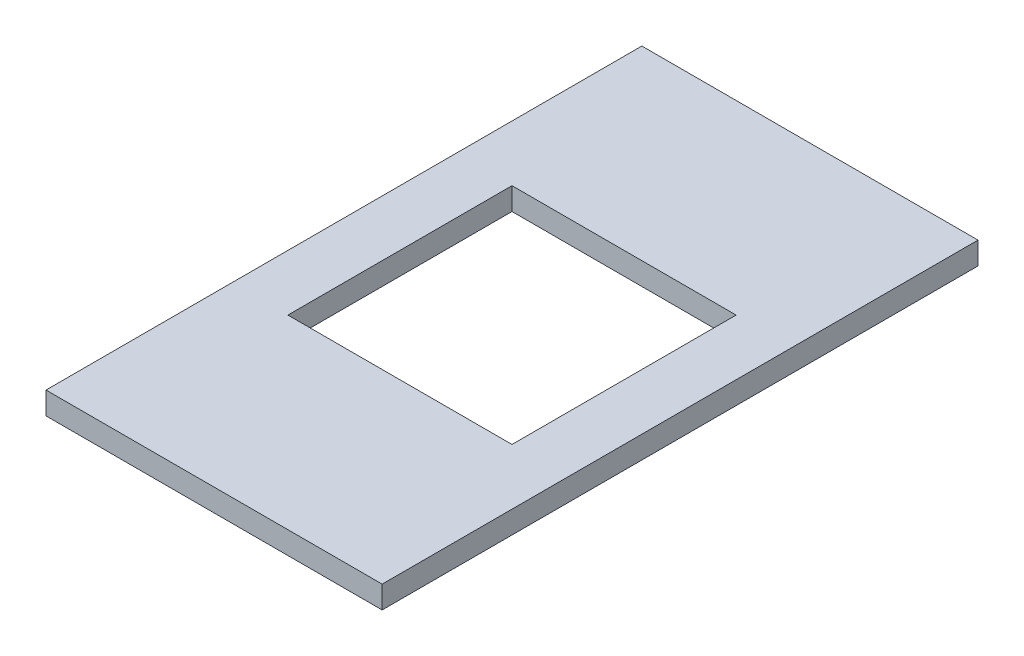
from build123d import *

# Parameters (mm, degrees)
SKETCH1_W           = 150
SKETCH1_H           = 30
BOSS_EXTRUDE1_DEPTH = 10
SKETCH9_W           = 150
SKETCH9_H           = 265.88
SKETCH9_W_2         = 100
SKETCH9_H_2         = 100
BOSS_EXTRUDE3_DEPTH = 10
SKETCH25_W          = 150
SKETCH25_H          = 30
CUT_EXTRUDE2_DEPTH  = 10


with BuildPart() as part:
    # Sketch1 → Boss-Extrude1 (new body)
    with BuildSketch(Plane(origin=(0, 0, 0), x_dir=(1, 0, 0), z_dir=(0, 1, 0))):
        with Locations((-75, 15)):
            Rectangle(SKETCH1_W, SKETCH1_H)
    extrude(amount=BOSS_EXTRUDE1_DEPTH)

    # Sketch9 → Boss-Extrude3 (add)
    with BuildSketch(Plane.XZ):
        with Locations((-75, -15)):
            Rectangle(SKETCH9_W, SKETCH9_H)
        with Locations((-75, -15)):
            Rectangle(SKETCH9_W_2, SKETCH9_H_2, mode=Mode.SUBTRACT)
    extrude(amount=BOSS_EXTRUDE3_DEPTH)

    # Sketch25 → Cut-Extrude2 (cut)
    with BuildSketch(Plane(origin=(0, 0, 0), x_dir=(1, 0, 0), z_dir=(0, 1, 0))):
        with Locations((-75, 15)):
            Rectangle(SKETCH25_W, SKETCH25_H)
    extrude(amount=CUT_EXTRUDE2_DEPTH, mode=Mode.SUBTRACT)


solid = part.part
